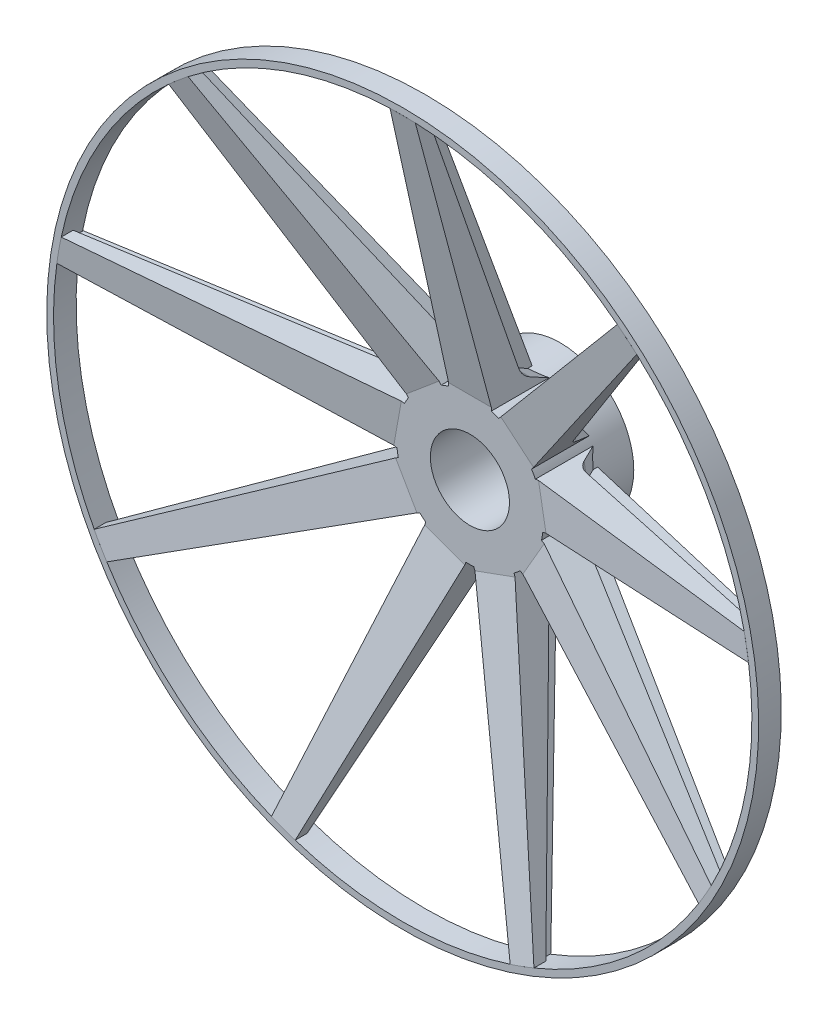
from build123d import *

# Parameters (mm, degrees)
SKETCH1_R                = 32.5
SKETCH1_R_2              = 17.5
BOSS_EXTRUDE1_DEPTH      = 40
BOSS_EXTRUDE2_DEPTH      = 9.5
BOSS_EXTRUDE2_DEPTH_BACK = 9.5
SKETCH6_W                = 19
SKETCH6_H                = 1.948836008
BOSS_EXTRUDE3_DEPTH      = 25
BOSS_EXTRUDE4_DEPTH      = 19
CUT_EXTRUDE3_DEPTH       = 7
CUT_EXTRUDE6_DEPTH       = 176.591074354
CIRPATTERN11_COUNT       = 9
SKETCH22_R               = 158.5
SKETCH22_R_2             = 154.5
CUT_EXTRUDE8_DEPTH       = 233.661583697
SKETCH23_R               = 157.5
SKETCH23_R_2             = 154.5
BOSS_EXTRUDE5_DEPTH      = 10


with BuildPart() as part:
    # Sketch1 → Boss-Extrude1 (new body)
    with BuildSketch(Plane.XY):
        Circle(SKETCH1_R)
        Circle(SKETCH1_R_2, mode=Mode.SUBTRACT)
    extrude(amount=BOSS_EXTRUDE1_DEPTH)



with BuildPart() as body_2:
    # Sketch4 → Boss-Extrude2 (new, two sides: drawn at the far end of the back side and taken through both)
    with BuildSketch(Plane(origin=(0, 0, 0), x_dir=(0, 0, -1), z_dir=(1, 0, 0)).offset(-BOSS_EXTRUDE2_DEPTH_BACK)):
        Polygon((-40, 32.5), (-15, 32.5), (-60.496279283, 157.5), (-70.496279283, 157.5), align=None)
    extrude(amount=BOSS_EXTRUDE2_DEPTH + BOSS_EXTRUDE2_DEPTH_BACK)


with BuildPart() as part_1:
    add(part.part)

    add(body_2.part)  # Boss-Extrude3 merges body 2
    # Sketch6 → Boss-Extrude3 (add)
    with BuildSketch(Plane.XY.offset(40)):
        with Locations((0, 31.525581996)):
            Rectangle(SKETCH6_W, SKETCH6_H)
    extrude(amount=-BOSS_EXTRUDE3_DEPTH)

    # Sketch7 → Boss-Extrude4 (add)
    with BuildSketch(Plane(origin=(9.5, 0, 0), x_dir=(0, 0, -1), z_dir=(1, 0, 0))):
        Polygon((-14.483359006, 31.080540536), (-15, 32.5), (-15, 31.080540536), align=None)
    extrude(amount=-BOSS_EXTRUDE4_DEPTH)

    # Sketch10 → Cut-Extrude3 (cut)
    with BuildSketch(Plane.ZY.offset(9.5)):
        with BuildLine():
            Line((65.496279283, 157.5), (27.682703456, 41.302064957))
            ThreePointArc((27.682703456, 41.302064957), (25.840932522, 37.976974294), (22.891351203, 35.57940925))
            Line((22.891351203, 35.57940925), (14.483359006, 31.080540536))
            Line((14.483359006, 31.080540536), (60.496279283, 157.5))
            Line((60.496279283, 157.5), (65.496279283, 157.5))
        make_face()
    cut_extrude3 = extrude(amount=-CUT_EXTRUDE3_DEPTH, mode=Mode.SUBTRACT)

    # Mirror1: Cut-Extrude3 across plane
    add(cut_extrude3.mirror(Plane(origin=(0, 0, 0), x_dir=(0, 0, 1), z_dir=(1, 0, 0))), mode=Mode.SUBTRACT)

    # Sketch20 → Cut-Extrude6 (cut, through all)
    with BuildSketch(Plane(origin=(0, 0, 0), x_dir=(-1, 0, 0), z_dir=(0, 0, -1))):
        Polygon((5.5, 157.5), (9.5, 29.704419373), (9.5, 157.5), align=None)
        Polygon((-5.5, 157.5), (-9.5, 31.080540536), (-9.5, 157.5), align=None)
    extrude(amount=-CUT_EXTRUDE6_DEPTH, mode=Mode.SUBTRACT)


with BuildPart() as cirpattern11_1:
    # CirPattern11: pattern copy
    add(part_1.part.rotate(Axis((0, 0, 0), (0, 0, 1)), 1 * 360 / CIRPATTERN11_COUNT))


with BuildPart() as cirpattern11_2:
    # CirPattern11: pattern copy
    add(part_1.part.rotate(Axis((0, 0, 0), (0, 0, 1)), 2 * 360 / CIRPATTERN11_COUNT))


with BuildPart() as cirpattern11_3:
    # CirPattern11: pattern copy
    add(part_1.part.rotate(Axis((0, 0, 0), (0, 0, 1)), 3 * 360 / CIRPATTERN11_COUNT))


with BuildPart() as cirpattern11_4:
    # CirPattern11: pattern copy
    add(part_1.part.rotate(Axis((0, 0, 0), (0, 0, 1)), 4 * 360 / CIRPATTERN11_COUNT))


with BuildPart() as cirpattern11_5:
    # CirPattern11: pattern copy
    add(part_1.part.rotate(Axis((0, 0, 0), (0, 0, 1)), 5 * 360 / CIRPATTERN11_COUNT))


with BuildPart() as cirpattern11_6:
    # CirPattern11: pattern copy
    add(part_1.part.rotate(Axis((0, 0, 0), (0, 0, 1)), 6 * 360 / CIRPATTERN11_COUNT))


with BuildPart() as cirpattern11_7:
    # CirPattern11: pattern copy
    add(part_1.part.rotate(Axis((0, 0, 0), (0, 0, 1)), 7 * 360 / CIRPATTERN11_COUNT))


with BuildPart() as cirpattern11_8:
    # CirPattern11: pattern copy
    add(part_1.part.rotate(Axis((0, 0, 0), (0, 0, 1)), 8 * 360 / CIRPATTERN11_COUNT))


with BuildPart() as cut_extrude8_tool:
    # Sketch22 → Cut-Extrude8 (new, through all)
    with BuildSketch(Plane(origin=(0, 0, 0), x_dir=(-1, 0, 0), z_dir=(0, 0, -1))):
        Circle(SKETCH22_R)
        Circle(SKETCH22_R_2, mode=Mode.SUBTRACT)
    extrude(amount=-CUT_EXTRUDE8_DEPTH)


with BuildPart() as part_2:
    add(part_1.part)

    # Cut-Extrude8: cut by cut_extrude8_tool
    add(cut_extrude8_tool.part, mode=Mode.SUBTRACT)


with BuildPart() as cirpattern11_1_1:
    add(cirpattern11_1.part)

    # Cut-Extrude8: cut by cut_extrude8_tool
    add(cut_extrude8_tool.part, mode=Mode.SUBTRACT)


with BuildPart() as cirpattern11_2_1:
    add(cirpattern11_2.part)

    # Cut-Extrude8: cut by cut_extrude8_tool
    add(cut_extrude8_tool.part, mode=Mode.SUBTRACT)


with BuildPart() as cirpattern11_3_1:
    add(cirpattern11_3.part)

    # Cut-Extrude8: cut by cut_extrude8_tool
    add(cut_extrude8_tool.part, mode=Mode.SUBTRACT)


with BuildPart() as cirpattern11_4_1:
    add(cirpattern11_4.part)

    # Cut-Extrude8: cut by cut_extrude8_tool
    add(cut_extrude8_tool.part, mode=Mode.SUBTRACT)


with BuildPart() as cirpattern11_5_1:
    add(cirpattern11_5.part)

    # Cut-Extrude8: cut by cut_extrude8_tool
    add(cut_extrude8_tool.part, mode=Mode.SUBTRACT)


with BuildPart() as cirpattern11_6_1:
    add(cirpattern11_6.part)

    # Cut-Extrude8: cut by cut_extrude8_tool
    add(cut_extrude8_tool.part, mode=Mode.SUBTRACT)


with BuildPart() as cirpattern11_7_1:
    add(cirpattern11_7.part)

    # Cut-Extrude8: cut by cut_extrude8_tool
    add(cut_extrude8_tool.part, mode=Mode.SUBTRACT)


with BuildPart() as cirpattern11_8_1:
    add(cirpattern11_8.part)

    # Cut-Extrude8: cut by cut_extrude8_tool
    add(cut_extrude8_tool.part, mode=Mode.SUBTRACT)


with BuildPart() as boss_extrude5_tool:
    # Sketch23 → Boss-Extrude5 (new body)
    with BuildSketch(Plane(origin=(9.07e-07, 2.236e-06, 69.739621776), x_dir=(-1.0, 0, 1.3005135487390581e-08), z_dir=(-1.3005135487390588e-08, -3.206550502228677e-08, -0.9999999999999994))):
        Circle(SKETCH23_R)
        Circle(SKETCH23_R_2, mode=Mode.SUBTRACT)
    extrude(amount=BOSS_EXTRUDE5_DEPTH)


with BuildPart() as part_3:
    add(part_2.part)


with BuildPart() as part_4:
    # Boss-Extrude5: joined with boss_extrude5_tool
    add(part_3.part.fuse(boss_extrude5_tool.part, cirpattern11_1_1.part, cirpattern11_2_1.part, cirpattern11_3_1.part, cirpattern11_4_1.part, cirpattern11_5_1.part, cirpattern11_6_1.part, cirpattern11_7_1.part, cirpattern11_8_1.part, tol=0.00001))


solid = part_4.part
